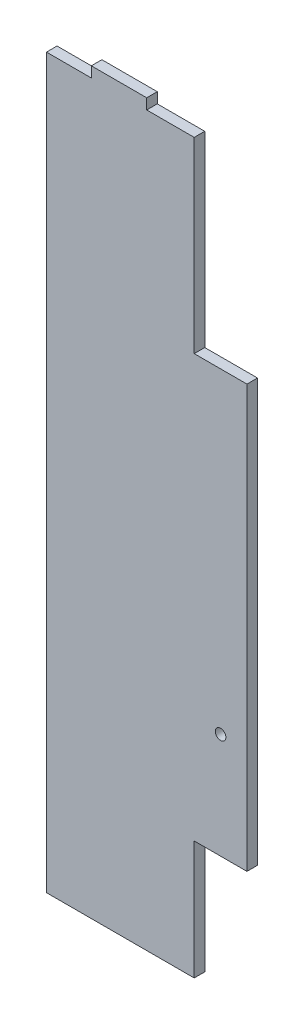
from build123d import *

# Parameters (mm, degrees)
SKETCH1_R           = 2
BOSS_EXTRUDE1_DEPTH = 4


with BuildPart() as part:
    # Sketch1 → Boss-Extrude1 (new body)
    with BuildSketch(Plane.XY):
        Polygon((16, 65), (16, 136), (-2, 136), (-2, 140), (-23, 140), (-23, 136), (-40, 136), (-40, -140), (16, -140), (16, -95), (36, -95), (36, 65), align=None)
        with Locations((26, -55)):
            Circle(SKETCH1_R, mode=Mode.SUBTRACT)
    extrude(amount=BOSS_EXTRUDE1_DEPTH)


solid = part.part
